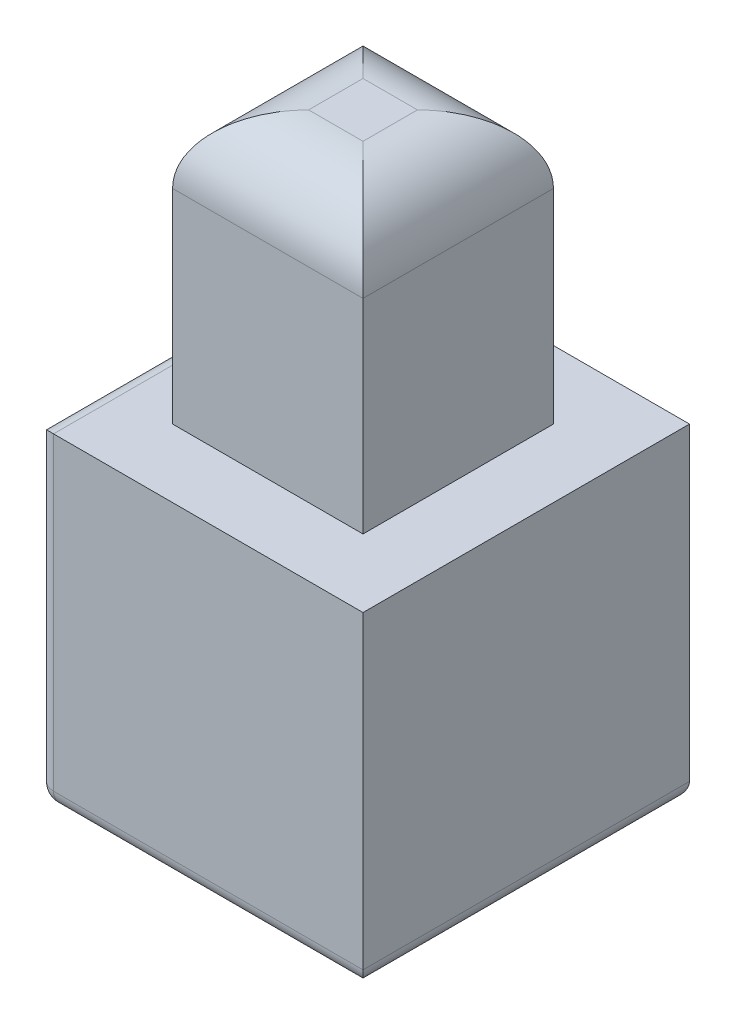
from build123d import *

# Parameters (mm, degrees)
SKETCH1_W           = 4.8
SKETCH1_H           = 4.8
BOSS_EXTRUDE1_DEPTH = 4.8
SKETCH2_W           = 2.8
SKETCH2_H           = 2.8
BOSS_EXTRUDE2_DEPTH = 4
FILLET1_R           = 1
FILLET2_R           = 0.25
FILLET3_R           = 0.25


with BuildPart() as part:
    # Sketch1 → Boss-Extrude1 (new body)
    with BuildSketch(Plane(origin=(0, 0, 0), x_dir=(1, 0, 0), z_dir=(0, 1, 0))):
        Rectangle(SKETCH1_W, SKETCH1_H)
    extrude(amount=BOSS_EXTRUDE1_DEPTH)

    # Sketch2 → Boss-Extrude2 (add)
    with BuildSketch(Plane(origin=(0, 4.8, 0), x_dir=(1, 0, 0), z_dir=(0, 1, 0))):
        Rectangle(SKETCH2_W, SKETCH2_H)
    extrude(amount=BOSS_EXTRUDE2_DEPTH)

    # Fillet1
    fillet1_edges = [part.edges().sort_by_distance(p)[0] for p in [
        (1.4, 8.8, 0),
        (0, 8.8, -1.4),
        (-1.4, 8.8, 0),
        (0, 8.8, 1.4),
    ]]
    fillet(fillet1_edges, radius=FILLET1_R)

    # Fillet2
    fillet2_edges = [part.edges().sort_by_distance(p)[0] for p in [
        (0, 0, 2.4),
        (-2.4, 0, 0),
        (0, 0, -2.4),
        (2.4, 0, 0),
    ]]
    fillet(fillet2_edges, radius=FILLET2_R)

    # Fillet3
    # the kernel refuses this fillet: 0.25 mm, written as the material it takes off along each edge
    with BuildSketch(Plane(origin=(-2.15, 0.25, 2.15), x_dir=(0, 0, 1), z_dir=(-1, 0, 0))) as fillet3_piece_1_section:
        Polygon((0, 0), (FILLET3_R, 0), (FILLET3_R, -FILLET3_R), (0, -FILLET3_R), align=None)
    fillet3_piece_1 = extrude(amount=FILLET3_R, mode=Mode.PRIVATE)
    fillet3_piece_1 = fillet3_piece_1 - Plane(origin=(-2.15, 0.25, 2.15), x_dir=(0, 0.7071067811865475, -0.7071067811865475), z_dir=(-1, 0, 0)) * Sphere(FILLET3_R, mode=Mode.PRIVATE)
    add(fillet3_piece_1, mode=Mode.SUBTRACT)
    with BuildSketch(Plane(origin=(-2.15, 0.25, -2.15), x_dir=(-1, 0, 0), z_dir=(0, 0, -1))) as fillet3_piece_2_section:
        Polygon((0, 0), (FILLET3_R, 0), (FILLET3_R, -FILLET3_R), (0, -FILLET3_R), align=None)
    fillet3_piece_2 = extrude(amount=FILLET3_R, mode=Mode.PRIVATE)
    fillet3_piece_2 = fillet3_piece_2 - Plane(origin=(-2.15, 0.25, -2.15), x_dir=(0.7071067811865475, 0.7071067811865475, 0), z_dir=(0, 0, -1)) * Sphere(FILLET3_R, mode=Mode.PRIVATE)
    add(fillet3_piece_2, mode=Mode.SUBTRACT)
    with BuildSketch(Plane(origin=(-2.4, 4.8, 3.025), x_dir=(0, -1, 0), z_dir=(0, 0, -1))) as fillet3_piece_3:
        with BuildLine():
            CenterArc((FILLET3_R, -FILLET3_R), FILLET3_R, 90, 90)
            Line((0, -FILLET3_R), (0, 0))
            Line((0, 0), (FILLET3_R, 0))
        make_face()
    extrude(amount=6.05, mode=Mode.SUBTRACT)
    with BuildSketch(Plane(origin=(-2.4, 0.25, 2.4), x_dir=(0, 0, -1), z_dir=(0, 1, 0)), Plane(origin=(-2.4, 0.25, -2.4), x_dir=(1, 0, 0), z_dir=(0, 1, 0))) as fillet3_piece_4:
        with BuildLine():
            CenterArc((FILLET3_R, -FILLET3_R), FILLET3_R, 90, 90)
            Line((0, -FILLET3_R), (0, 0))
            Line((0, 0), (FILLET3_R, 0))
        make_face()
    extrude(amount=5.175, mode=Mode.SUBTRACT)


solid = part.part
